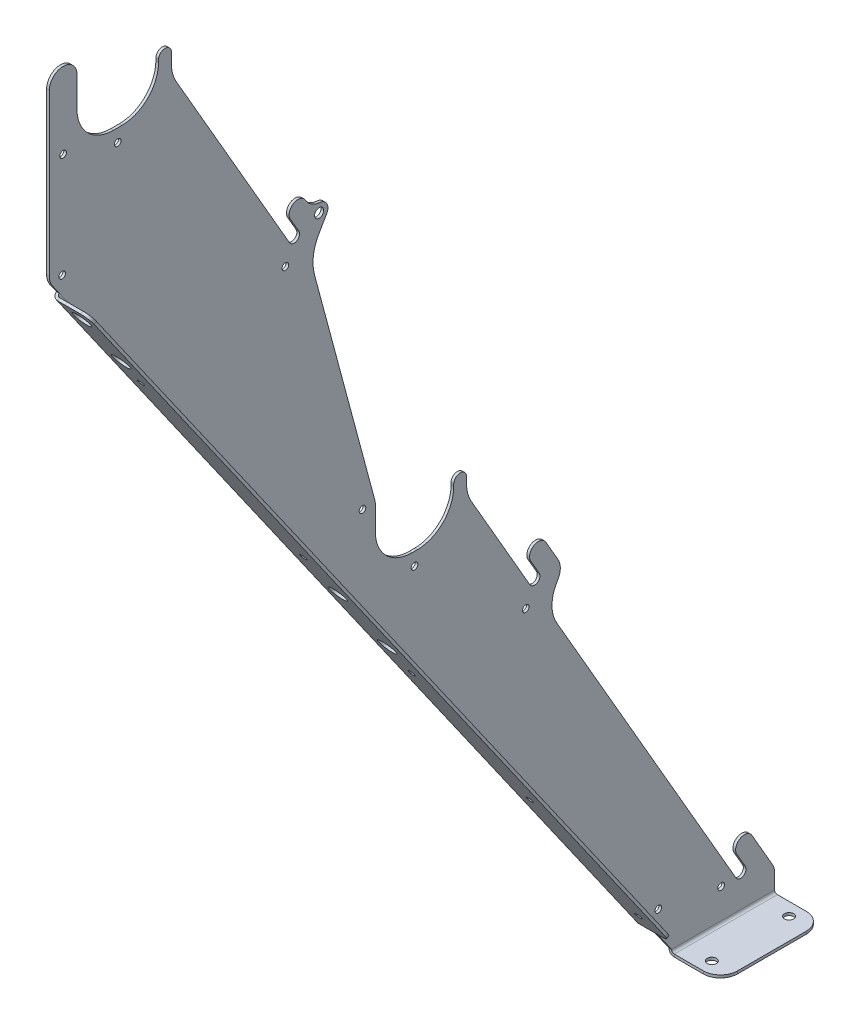
from build123d import *

# Parameters (mm, degrees)
BASE_FLANGE1_DEPTH                = 1.984375
LOW_RING_SLOT_ONLY_DEPTH          = 915.762916455
HIGH_RING_SLOT_ONLY_DEPTH         = 915.762916455
RING_HOLES_VERTICAL_DEPTH         = 915.762916455
HOOKS_DEPTH                       = 1.984375
CHAIN_PIN_HOLE_D                  = 6.7564
RING_RETAINER_LIP_DEPTH           = 1.984375
ROUNDING_TOP_DEPTH                = 915.762916455
BACK_FLANGE_DEPTH                 = 749.3
BOTTOM_FLANGE_DEPTH               = 76.2
RIVET_HOLES_HOLE_WIZARD_D         = 4.9149
ROUNDING_REMAINING_EDGES_R        = 12.7
BOLT_TO_BASE_HOLE_WIZARD_D        = 6.7564
HOLES_FOR_120LB_CABLE_TIES_D      = 12.7
RIVETS_TO_BACKING_PART_D          = 4.9149
FILLET_FOR_FLANGE_TO_BACK_PIECE_R = 6.35
FILLET_FOR_BOTTOM_FLANGE_R        = 12.7


# Sheet-metal steps are written as plain solids
with BuildPart() as part:
    # Sketch1 → Base-Flange1 (new body)
    with BuildSketch(Plane(origin=(0, 0, 0), x_dir=(0, 0, -1), z_dir=(1, 0, 0))):
        Polygon((-460.1938993, 657.225), (0, 0), (76.2, 0), (76.2, 14.2875), (52.076108029, 14.2875), (-396.113689065, 790.575), (-460.1938993, 790.575), align=None)
    extrude(amount=-BASE_FLANGE1_DEPTH)

    # Sketch2 → low ring slot only (cut, through all)
    with BuildSketch(Plane(origin=(0, 0, 0), x_dir=(0, 0, -1), z_dir=(1, 0, 0))):
        with BuildLine():
            Line((-192.0875, 404.01875), (-188.11875, 404.01875))
            ThreePointArc((-188.11875, 404.01875), (-161.13125, 377.03125), (-188.11875, 350.04375))
            Line((-188.11875, 350.04375), (-192.0875, 350.04375))
            ThreePointArc((-192.0875, 350.04375), (-219.075, 377.03125), (-192.0875, 404.01875))
        make_face()
    extrude(amount=-LOW_RING_SLOT_ONLY_DEPTH, mode=Mode.SUBTRACT)

    # Sketch3 → high ring slot only (cut, through all)
    with BuildSketch(Plane(origin=(0, 0, 0), x_dir=(0, 0, -1), z_dir=(1, 0, 0))):
        with BuildLine():
            Line((-412.75, 785.01875), (-406.4, 785.01875))
            ThreePointArc((-406.4, 785.01875), (-379.4125, 758.03125), (-406.4, 731.04375))
            Line((-406.4, 731.04375), (-412.75, 731.04375))
            ThreePointArc((-412.75, 731.04375), (-439.7375, 758.03125), (-412.75, 785.01875))
        make_face()
    extrude(amount=-HIGH_RING_SLOT_ONLY_DEPTH, mode=Mode.SUBTRACT)

    # Sketch6 → ring holes vertical (cut, through all)
    with BuildSketch(Plane(origin=(0, 0, 0), x_dir=(0, 0, -1), z_dir=(1, 0, 0))):
        Polygon((-157.35409368, 377.03125), (-263.001872817, 560.018571172), (-219.075, 396.08125), (-219.075, 377.03125), (-161.13125, 377.03125), align=None)
        Polygon((-439.7375, 758.03125), (-439.7375, 790.575), (-396.113689065, 790.575), (-377.324546242, 758.03125), (-379.4125, 758.03125), align=None)
    extrude(amount=-RING_HOLES_VERTICAL_DEPTH, mode=Mode.SUBTRACT)

    # Sketch4 → hooks (add)
    with BuildSketch(Plane(origin=(0, 0, 0), x_dir=(0, 0, -1), z_dir=(1, 0, 0))):
        with BuildLine():
            ThreePointArc((54.499076643, 25.965795256), (53.046413321, 20.544381935), (47.625, 21.997045256))
            Line((47.625, 21.997045256), (52.076108029, 14.2875))
            Line((52.076108029, 14.2875), (76.2, 14.2875))
            Line((76.2, 14.2875), (59.4315198, 43.331359673))
            ThreePointArc((59.4315198, 43.331359673), (50.58349781, 45.702180019), (48.212677464, 36.85415803))
            Line((48.212677464, 36.85415803), (54.499076643, 25.965795256))
        make_face()
        with BuildLine():
            ThreePointArc((-97.900923357, 289.93033833), (-99.353586679, 284.508925008), (-104.775, 285.96158833))
            Line((-104.775, 285.96158833), (-85.061678589, 251.817114059))
            ThreePointArc((-85.061678589, 251.817114059), (-88.464633332, 264.517114059), (-85.061678589, 277.217114059))
            Line((-85.061678589, 277.217114059), (-83.998255231, 279.059017344))
            ThreePointArc((-83.998255231, 279.059017344), (-82.296777859, 285.409017344), (-83.998255231, 291.759017344))
            Line((-83.998255231, 291.759017344), (-92.9684802, 307.295902746))
            ThreePointArc((-92.9684802, 307.295902746), (-101.81650219, 309.666723093), (-104.187322536, 300.818701104))
            Line((-104.187322536, 300.818701104), (-97.900923357, 289.93033833))
        make_face()
        with BuildLine():
            ThreePointArc((-264.101571882, 564.122703953), (-264.925165118, 576.688308533), (-260.877417362, 588.612588904))
            Line((-260.877417362, 588.612588904), (-255.028316879, 598.743528119))
            ThreePointArc((-255.028316879, 598.743528119), (-255.028316879, 605.241589069), (-260.655802737, 608.490619543))
            ThreePointArc((-260.655802737, 608.490619543), (-266.499869955, 610.694851427), (-270.7684802, 615.254536332))
            ThreePointArc((-270.7684802, 615.254536332), (-279.61650219, 617.625356679), (-281.987322536, 608.77733469))
            Line((-281.987322536, 608.77733469), (-275.700923357, 597.888971915))
            ThreePointArc((-275.700923357, 597.888971915), (-277.153586679, 592.467558594), (-282.575, 593.920221915))
            Line((-282.575, 593.920221915), (-263.001872817, 560.018571172))
            Line((-263.001872817, 560.018571172), (-264.101571882, 564.122703953))
        make_face()
    extrude(amount=-HOOKS_DEPTH)

    # chain pin hole (through all)
    with Locations(Plane(origin=(0, 0, 0), x_dir=(0, 0, -1), z_dir=(1, 0, 0))):
        with Locations((-260.655802737, 601.992558594)):
            Hole(CHAIN_PIN_HOLE_D / 2)

    # Sketch7 → ring retainer lip (add)
    with BuildSketch(Plane(origin=(0, 0, 0), x_dir=(0, 0, -1), z_dir=(1, 0, 0))):
        with BuildLine():
            Line((-161.13125, 377.03125), (-161.13125, 378.61875))
            ThreePointArc((-161.13125, 378.61875), (-156.36875, 383.38125), (-151.60625, 378.61875))
            Line((-151.60625, 378.61875), (-151.60625, 373.881602199))
            ThreePointArc((-151.60625, 373.881602199), (-150.740765988, 367.307598454), (-148.203295256, 361.181602199))
            Line((-148.203295256, 361.181602199), (-157.35409368, 377.03125))
            Line((-157.35409368, 377.03125), (-161.13125, 377.03125))
        make_face()
        with BuildLine():
            Line((-379.4125, 758.03125), (-379.4125, 759.61875))
            ThreePointArc((-379.4125, 759.61875), (-374.65, 764.38125), (-369.8875, 759.61875))
            Line((-369.8875, 759.61875), (-369.8875, 751.955817539))
            ThreePointArc((-369.8875, 751.955817539), (-369.022015988, 745.381813793), (-366.484545256, 739.255817539))
            Line((-366.484545256, 739.255817539), (-377.324546242, 758.03125))
            Line((-377.324546242, 758.03125), (-379.4125, 758.03125))
        make_face()
    extrude(amount=-RING_RETAINER_LIP_DEPTH)

    # Sketch9 → rounding top (cut, through all)
    with BuildSketch(Plane(origin=(0, 0, 0), x_dir=(0, 0, -1), z_dir=(1, 0, 0))):
        with BuildLine():
            Line((-460.1938993, 790.575), (-460.1938993, 780.34680035))
            ThreePointArc((-460.1938993, 780.34680035), (-457.198128982, 787.579229682), (-449.96569965, 790.575))
            Line((-449.96569965, 790.575), (-460.1938993, 790.575))
        make_face()
        with BuildLine():
            Line((-439.7375, 790.575), (-449.96569965, 790.575))
            ThreePointArc((-449.96569965, 790.575), (-442.733270318, 787.579229682), (-439.7375, 780.34680035))
            Line((-439.7375, 780.34680035), (-439.7375, 790.575))
        make_face()
    extrude(amount=-ROUNDING_TOP_DEPTH, mode=Mode.SUBTRACT)

    # back flange section (across the edge) → back flange (add)
    with BuildSketch(Plane(origin=(0, 645.683578297, 454.534983396), x_dir=(3.4914813388431334e-15, 0.5735764363510447, -0.8191520442889929), z_dir=(0, -0.8191520442889929, -0.5735764363510447))):
        with BuildLine():
            Line((-1.984375, 1.984375), (-1.984375, 25.4))
            Line((-1.984375, 25.4), (0, 25.4))
            Line((0, 25.4), (0, 1.984375))
            ThreePointArc((0, 1.984375), (0.581209981, 0.581209981), (1.984375, 0))
            Line((1.984375, 0), (1.984375, -1.984375))
            ThreePointArc((1.984375, -1.984375), (-0.821955038, -0.821955038), (-1.984375, 1.984375))
        make_face()
    extrude(amount=BACK_FLANGE_DEPTH)

    # bottom flange section (across the edge) → bottom flange (add)
    with BuildSketch(Plane(origin=(0, -1.984375, 0), x_dir=(0, 1, 0), z_dir=(0, 0, -1))):
        with BuildLine():
            Line((-1.984375, 1.984375), (-1.984375, 36.115625))
            Line((-1.984375, 36.115625), (0, 36.115625))
            Line((0, 36.115625), (0, 1.984375))
            ThreePointArc((0, 1.984375), (0.581209981, 0.581209981), (1.984375, 0))
            Line((1.984375, 0), (1.984375, -1.984375))
            ThreePointArc((1.984375, -1.984375), (-0.821955038, -0.821955038), (-1.984375, 1.984375))
        make_face()
    extrude(amount=BOTTOM_FLANGE_DEPTH)

    # rivet holes hole wizard (through all)
    with Locations(Plane(origin=(0, 0, 0), x_dir=(0, 0, -1), z_dir=(1, 0, 0))):
        with Locations((-449.96569965, 734.21875), (-409.575, 721.51875), (-450.6688993, 657.225), (-285.636022628, 580.17206863), (-228.6, 396.08125), (-190.103125, 340.51875), (-107.836022628, 272.213435045), (-9.862916022, 30.692034586), (36.626477372, 21.997045256)):
            Hole(RIVET_HOLES_HOLE_WIZARD_D / 2)

    # rounding remaining edges
    rounding_remaining_edges_edges = [part.edges().sort_by_distance(p)[0] for p in [
        (-0.9921875, 657.225, 460.1938993),
        (-0.9921875, 14.2875, -76.2),
        (-0.9921875, 396.08125, 219.075),
    ]]
    fillet(rounding_remaining_edges_edges, radius=ROUNDING_REMAINING_EDGES_R)

    # bolt to base hole wizard (through all)
    with Locations(Plane(origin=(0, -1.984375, 0), x_dir=(1, 0, 0), z_dir=(0, 1, 0))):
        with Locations((20.240625, 66.675), (20.240625, 9.525)):
            Hole(BOLT_TO_BASE_HOLE_WIZARD_D / 2)

    # holes for 120lb cable ties (through all)
    with Locations(Plane(origin=(0, -1.138190741, 1.625504838), x_dir=(-1, 0, 0), z_dir=(3.580478189914983e-15, 0.5735764363510447, -0.8191520442889927))):
        with Locations((-12.7, 776.923579099), (-12.7, 726.123579099), (-12.7, 446.723579099), (-12.7, 383.223579099)):
            Hole(HOLES_FOR_120LB_CABLE_TIES_D / 2)

    # rivets to backing part (through all)
    with Locations(Plane(origin=(0, -1.138190741, 1.625504838), x_dir=(-1, 0, 0), z_dir=(3.580478189914983e-15, 0.5735764363510447, -0.8191520442889927))):
        with Locations((-12.7, 700.723579099), (-12.7, 491.173579099), (-12.7, 351.473579099), (-12.7, 199.073579099), (-12.7, 59.373579099)):
            Hole(RIVETS_TO_BACKING_PART_D / 2)

    # fillet for flange to back piece
    fillet_for_flange_to_back_piece_edges = [part.edges().sort_by_distance(p)[0] for p in [
        (25.4, 645.114482926, 455.347735815),
        (25.4, 31.32385614, 25.566912057),
    ]]
    fillet(fillet_for_flange_to_back_piece_edges, radius=FILLET_FOR_FLANGE_TO_BACK_PIECE_R)

    # fillet for bottom flange
    fillet_for_bottom_flange_edges = [part.edges().sort_by_distance(p)[0] for p in [
        (36.115625, -2.9765625, 0),
        (36.115625, -2.9765625, -76.2),
    ]]
    fillet(fillet_for_bottom_flange_edges, radius=FILLET_FOR_BOTTOM_FLANGE_R)


solid = part.part
